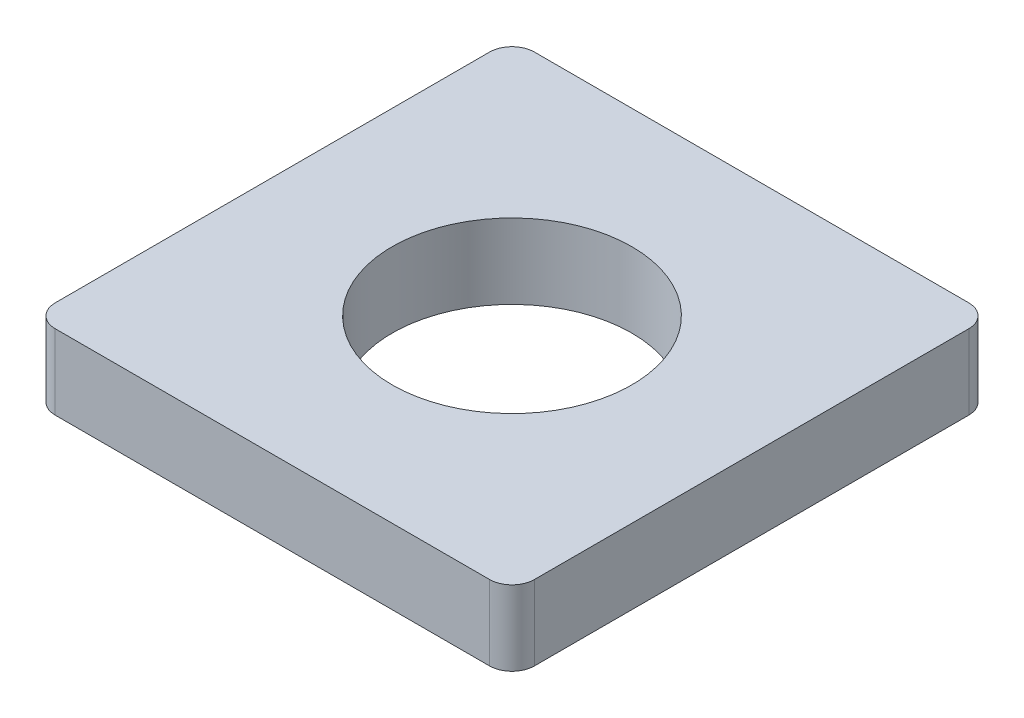
from build123d import *

# Parameters (mm, degrees)
SKETCH1_W            = 6.4
SKETCH1_H            = 6.4
BOSS_EXTRUDE1_DEPTH  = 1
M3_CLEARANCE_HOLE1_D = 3.2
FILLET1_R            = 0.3


with BuildPart() as part:
    # Sketch1 → Boss-Extrude1 (new body)
    with BuildSketch(Plane(origin=(0, 0, 0), x_dir=(1, 0, 0), z_dir=(0, 1, 0))):
        Rectangle(SKETCH1_W, SKETCH1_H)
    extrude(amount=BOSS_EXTRUDE1_DEPTH)

    # M3 Clearance Hole1 (through all)
    with Locations(Plane(origin=(0, 1, 0), x_dir=(1, 0, 0), z_dir=(0, 1, 0))):
        with Locations((0, 0)):
            Hole(M3_CLEARANCE_HOLE1_D / 2)

    # Fillet1
    fillet1_edges = [part.edges().sort_by_distance(p)[0] for p in [
        (3.2, 0.5, 3.2),
        (3.2, 0.5, -3.2),
        (-3.2, 0.5, -3.2),
        (-3.2, 0.5, 3.2),
    ]]
    fillet(fillet1_edges, radius=FILLET1_R)


solid = part.part
